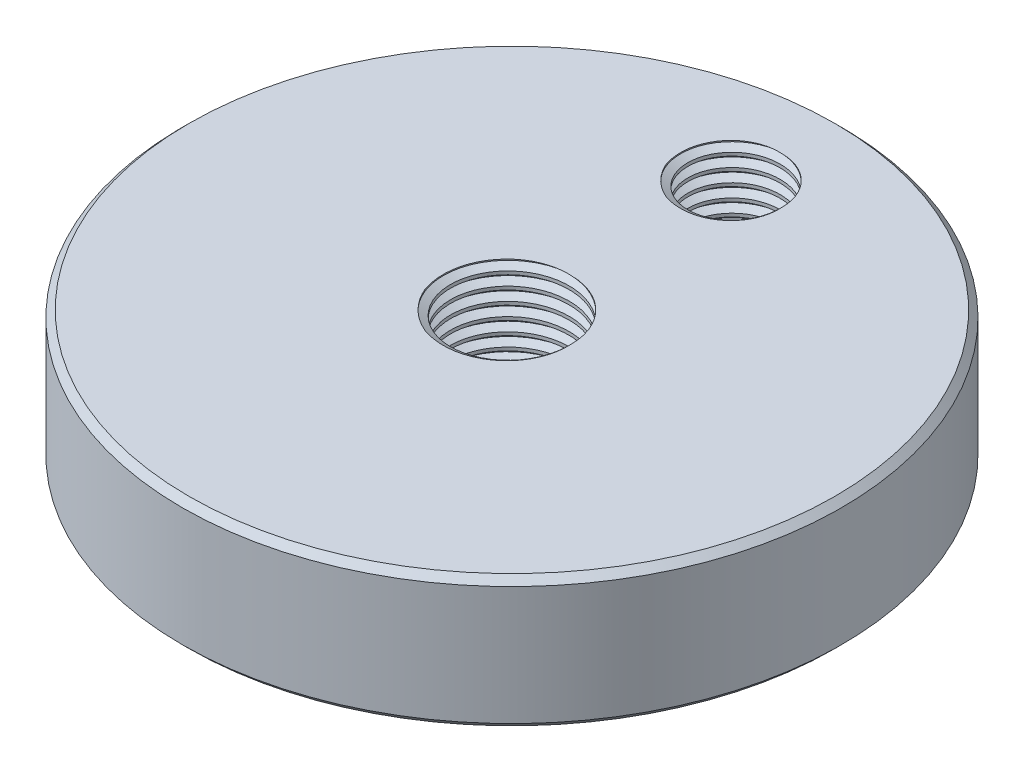
from build123d import *

# Parameters (mm, degrees)
SKETCH1_R                        = 25
BOSS_EXTRUDE1_DEPTH              = 10
TAP_DRILL_FOR_M10X1_0_TAP1_D     = 9
TAP_DRILL_FOR_M10X1_0_TAP1_DEPTH = 10
TAP_DRILL_FOR_M10X1_0_TAP1_TIP   = 2.703872786
THREAD1_PITCH                    = 1
TAP_DRILL_FOR_M8X1_0_TAP1_D      = 7
TAP_DRILL_FOR_M8X1_0_TAP1_DEPTH  = 10
TAP_DRILL_FOR_M8X1_0_TAP1_TIP    = 2.103012167
THREAD2_PITCH                    = 1
CHAMFER1_SIZE                    = 0.5


with BuildPart() as part:
    # Sketch1 → Boss-Extrude1 (new body)
    with BuildSketch(Plane(origin=(0, 0, 0), x_dir=(1, 0, 0), z_dir=(0, 1, 0))):
        with Locations(Location((0, 0, 0), (0, 0, 270))):
            Circle(SKETCH1_R)
    extrude(amount=BOSS_EXTRUDE1_DEPTH)

    # Tap Drill for M10x1.0 Tap1
    with Locations(Plane(origin=(0, 0, 0), x_dir=(-1, 0, 0), z_dir=(0, -1, 0))):
        with Locations((0, 0)):
            Hole(TAP_DRILL_FOR_M10X1_0_TAP1_D / 2, depth=TAP_DRILL_FOR_M10X1_0_TAP1_DEPTH)
            with Locations((0, 0, -(TAP_DRILL_FOR_M10X1_0_TAP1_DEPTH + TAP_DRILL_FOR_M10X1_0_TAP1_TIP / 2))):  # 118° drill point
                Cone(0, TAP_DRILL_FOR_M10X1_0_TAP1_D / 2, TAP_DRILL_FOR_M10X1_0_TAP1_TIP, mode=Mode.SUBTRACT)

    # Thread1: the profile of Thread Profile2 profile screwed along a right-hand helix of 11 turns, 8 arcs to a turn; built about Z, then put on its axis
    thread1_z = Axis((0, 0, 0), (0, 0, 1))
    thread1_corners = [(4.4997, 0, -0.000173205), (5.041265875, 0, 0.312499999), (5.041265875, 0, 0.437499999), (4.4997, 0, 0.750173202)]
    with BuildLine(mode=Mode.PRIVATE) as thread1_profile:
        Line(thread1_corners[0], thread1_corners[1])
        Line(thread1_corners[1], thread1_corners[2])
        Line(thread1_corners[2], thread1_corners[3])
        Line(thread1_corners[3], thread1_corners[0])
    thread1_cap = Face(thread1_profile.wire())
    thread1_turn_angles = [0, 22.5, 45, 67.5, 90, 112.5, 135, 157.5, 180, 202.5, 225, 247.5, 270, 292.5, 315, 337.5, 360]
    thread1_turn_weights = [1, 0.9238795325112867, 1, 0.9238795325112867, 1, 0.9238795325112867, 1, 0.9238795325112867, 1, 0.9238795325112867, 1, 0.9238795325112867, 1, 0.9238795325112867, 1, 0.9238795325112867, 1]
    thread1_turn_rails = [Edge.make_bspline([Vector(p[0], p[1], 0).rotate(thread1_z, thread1_turn_angles[k]) / thread1_turn_weights[k] + Vector(0, 0, p[2] + THREAD1_PITCH * thread1_turn_angles[k] / 360) for k in range(17)], [0, 0, 0, 1, 1, 2, 2, 3, 3, 4, 4, 5, 5, 6, 6, 7, 7, 8, 8, 8], 2, thread1_turn_weights) for p in thread1_corners]
    thread1_turn_sides = [Face.make_surface_from_curves(thread1_turn_rails[p[0]], thread1_turn_rails[p[1]]) for p in [(0, 1), (1, 2), (2, 3), (3, 0)]]
    thread1 = Plane(origin=(0, -1, 0), x_dir=(1, 0, 0), z_dir=(0, 1, 0)) * Solid(Shell([*[p.moved(Location((0, 0, THREAD1_PITCH * i))) for i in range(11) for p in thread1_turn_sides], thread1_cap, thread1_cap.rotate(thread1_z, 3960).moved(Location((0, 0, THREAD1_PITCH * 3960 / 360)))]))
    add(thread1, mode=Mode.SUBTRACT)

    # Tap Drill for M8x1.0 Tap1
    with Locations(Plane(origin=(0, 0, 0), x_dir=(-1, 0, 0), z_dir=(0, -1, 0))):
        with Locations((0, 17)):
            Hole(TAP_DRILL_FOR_M8X1_0_TAP1_D / 2, depth=TAP_DRILL_FOR_M8X1_0_TAP1_DEPTH)
            with Locations((0, 0, -(TAP_DRILL_FOR_M8X1_0_TAP1_DEPTH + TAP_DRILL_FOR_M8X1_0_TAP1_TIP / 2))):  # 118° drill point
                Cone(0, TAP_DRILL_FOR_M8X1_0_TAP1_D / 2, TAP_DRILL_FOR_M8X1_0_TAP1_TIP, mode=Mode.SUBTRACT)

    # Thread2: the profile of Thread Profile3 profile screwed along a right-hand helix of 11 turns, 8 arcs to a turn; built about Z, then put on its axis
    thread2_z = Axis((0, 0, 0), (0, 0, 1))
    thread2_corners = [(3.4997, 0, -0.000173205), (4.041265875, 0, 0.312499999), (4.041265875, 0, 0.437499999), (3.4997, 0, 0.750173202)]
    with BuildLine(mode=Mode.PRIVATE) as thread2_profile:
        Line(thread2_corners[0], thread2_corners[1])
        Line(thread2_corners[1], thread2_corners[2])
        Line(thread2_corners[2], thread2_corners[3])
        Line(thread2_corners[3], thread2_corners[0])
    thread2_cap = Face(thread2_profile.wire())
    thread2_turn_angles = [0, 22.5, 45, 67.5, 90, 112.5, 135, 157.5, 180, 202.5, 225, 247.5, 270, 292.5, 315, 337.5, 360]
    thread2_turn_weights = [1, 0.9238795325112867, 1, 0.9238795325112867, 1, 0.9238795325112867, 1, 0.9238795325112867, 1, 0.9238795325112867, 1, 0.9238795325112867, 1, 0.9238795325112867, 1, 0.9238795325112867, 1]
    thread2_turn_rails = [Edge.make_bspline([Vector(p[0], p[1], 0).rotate(thread2_z, thread2_turn_angles[k]) / thread2_turn_weights[k] + Vector(0, 0, p[2] + THREAD2_PITCH * thread2_turn_angles[k] / 360) for k in range(17)], [0, 0, 0, 1, 1, 2, 2, 3, 3, 4, 4, 5, 5, 6, 6, 7, 7, 8, 8, 8], 2, thread2_turn_weights) for p in thread2_corners]
    thread2_turn_sides = [Face.make_surface_from_curves(thread2_turn_rails[p[0]], thread2_turn_rails[p[1]]) for p in [(0, 1), (1, 2), (2, 3), (3, 0)]]
    thread2 = Plane(origin=(0, -1, -17), x_dir=(1, 0, 0), z_dir=(0, 1, 0)) * Solid(Shell([*[p.moved(Location((0, 0, THREAD2_PITCH * i))) for i in range(11) for p in thread2_turn_sides], thread2_cap, thread2_cap.rotate(thread2_z, 3960).moved(Location((0, 0, THREAD2_PITCH * 3960 / 360)))]))
    add(thread2, mode=Mode.SUBTRACT)

    # Chamfer1
    chamfer1_edges = [part.edges().sort_by_distance(p)[0] for p in [
        (0, 0, -25),
        (0, 10, -25),
    ]]
    chamfer(chamfer1_edges, length=CHAMFER1_SIZE)


solid = part.part
